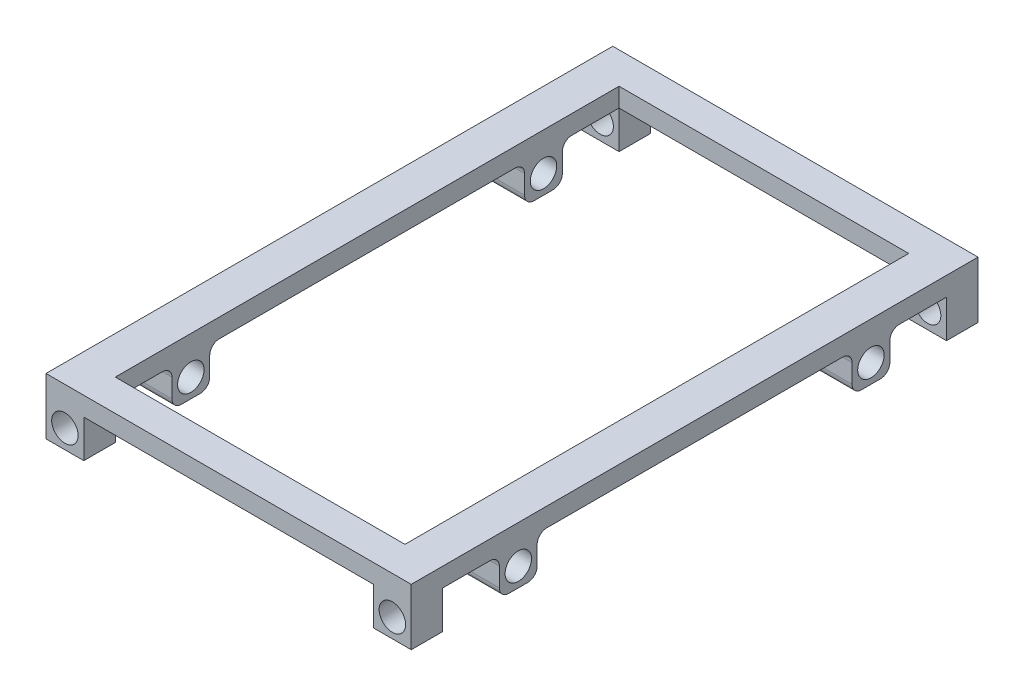
from build123d import *

# Parameters (mm, degrees)
SKETCH1_R               = 2.1
BOSS_EXTRUDE1_DEPTH     = 6
FILLET1_R               = 1.5
SKETCH2_R               = 2.1
CUT_EXTRUDE1_DEPTH      = 5
CUT_EXTRUDE2_START      = -85
SKETCH2_2_R             = 2.1
CUT_EXTRUDE2_DEPTH      = 5
SKETCH4_W               = 23
SKETCH4_H               = 3
BOSS_EXTRUDE2_DEPTH     = 5
BOSS_EXTRUDE3_START     = -3
BOSS_EXTRUDE3_OUTLINE_W = 23
BOSS_EXTRUDE3_OUTLINE_H = 5
BOSS_EXTRUDE3_DEPTH     = 3


# Read off the part's stored shape, not the designer's step: Boss-Extrude3
with BuildPart() as part:
    # Sketch1 → Boss-Extrude1 (new body)
    with BuildSketch(Plane(origin=(0, 0, 0), x_dir=(0, 0, -1), z_dir=(1, 0, 0))):
        Polygon((84, 0), (3, 0), (3, -9), (8, -9), (8, -3), (17, -3), (17, -9), (23, -9), (23, -3), (73, -3), (73, -9), (79, -9), (79, -3), (88, -3), (88, -9), (93, -9), (93, 0), align=None)
        with Locations((20, -6)):
            Circle(SKETCH1_R, mode=Mode.SUBTRACT)
        with Locations((76, -6)):
            Circle(SKETCH1_R, mode=Mode.SUBTRACT)
    extrude(amount=BOSS_EXTRUDE1_DEPTH)

    # Fillet1
    fillet1_edges = [part.edges().sort_by_distance(p)[0] for p in [
        (3, -9, -23),
        (3, -9, -17),
        (3, -3, -17),
        (3, -3, -79),
        (3, -9, -79),
        (3, -9, -73),
        (3, -3, -73),
        (3, -3, -23),
    ]]
    fillet(fillet1_edges, radius=FILLET1_R)

    # Sketch2 → Cut-Extrude1 (cut)
    with BuildSketch(Plane.XY.offset(-3)):
        with Locations((3, -6)):
            Circle(SKETCH2_R)
    extrude(amount=-CUT_EXTRUDE1_DEPTH, mode=Mode.SUBTRACT)

    # Sketch2<2> → Cut-Extrude2 (cut)
    with BuildSketch(Plane.XY.offset(-3).offset(CUT_EXTRUDE2_START)):
        with Locations((3, -6)):
            Circle(SKETCH2_2_R)
    extrude(amount=-CUT_EXTRUDE2_DEPTH, mode=Mode.SUBTRACT)

    # Sketch4 → Boss-Extrude2 (add)
    with BuildSketch(Plane.XY.offset(-3)):
        with Locations((17.5, -1.5)):
            Rectangle(SKETCH4_W, SKETCH4_H)
    extrude(amount=-BOSS_EXTRUDE2_DEPTH)

    # Boss-Extrude3 outline → Boss-Extrude3 (add)
    with BuildSketch(Plane(origin=(0, 0, 0), x_dir=(1, 0, 0), z_dir=(0, 1, 0)).offset(BOSS_EXTRUDE3_START)):
        with Locations((17.5, 90.5)):
            Rectangle(BOSS_EXTRUDE3_OUTLINE_W, BOSS_EXTRUDE3_OUTLINE_H)
    extrude(amount=BOSS_EXTRUDE3_DEPTH)

    # Mirror1: part across plane


with BuildPart() as part_1:
    add(part.part)
    add(part.part.mirror(Plane(origin=(29, 0, 0), x_dir=(0, 0, 1), z_dir=(1, 0, 0))))


solid = part_1.part
